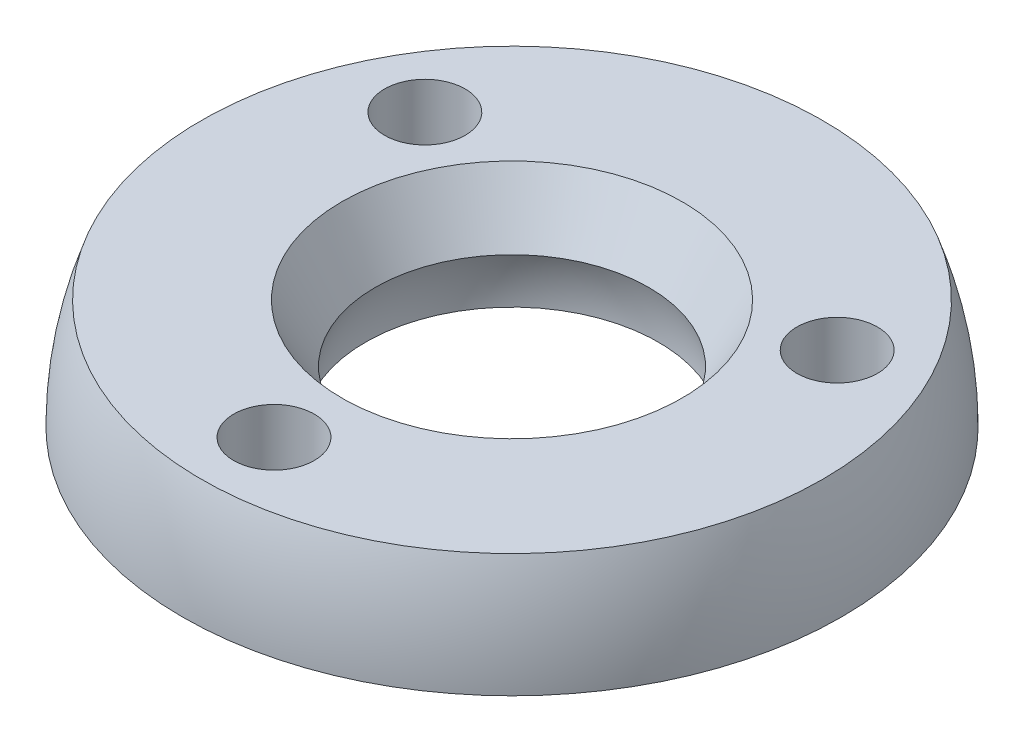
from build123d import *

# Parameters (mm, degrees)
REVOLVE1_ANGLE     = 180
CHAMFER2_SIZE      = 2
SKETCH2_R          = 1.1
CUT_EXTRUDE1_DEPTH = 10


# Read off the part's stored shape, not the designer's step: Body-Delete/Keep 1
with BuildPart() as part:
    # Sketch1 → Revolve1 (revolve)
    with BuildSketch(Plane(origin=(0, 0, 0), x_dir=(1, 0, 0), z_dir=(0, 1, 0))):
        with BuildLine():
            ThreePointArc((9, 0), (6.363961031, 6.363961031), (0, 9))
            Line((0, 9), (0, 4))
            ThreePointArc((0, 4), (2.828427125, 2.828427125), (4, 0))
            ThreePointArc((4, 0), (2.828427125, -2.828427125), (0, -4))
            Line((0, -4), (0, -9))
            ThreePointArc((0, -9), (6.363961031, -6.363961031), (9, 0))
        make_face()
    revolve(axis=Axis((0, 0, -9), (0, 0, 1)), revolution_arc=REVOLVE1_ANGLE)


with BuildPart() as body_2:
    # Split1: the piece on the far side of the plane
    add(part.part)
    split(bisect_by=Plane(origin=(0, 3, 0), x_dir=(-1, 0, 0), z_dir=(0, -1, 0)), keep=Keep.BOTTOM)


with BuildPart() as part_1:
    add(part.part)

    # Split1
    split(bisect_by=Plane(origin=(0, 3, 0), x_dir=(-1, 0, 0), z_dir=(0, -1, 0)), keep=Keep.TOP)

    # Chamfer2
    # the kernel refuses this chamfer: 2, 1.766969722 mm, written as the material it takes off along each edge
    with BuildSketch(Plane(origin=(0, 3, 0), x_dir=(1, 0, 0), z_dir=(0, 0, -1))) as chamfer2_piece_1:
        with BuildLine():
            Line((2.645751311 + CHAMFER2_SIZE, 0), (3.73710994, 1.573813021))
            ThreePointArc((3.73710994, 1.573813021), (3.297092522, 0.735230497), (2.645751311, 0))
            Line((2.645751311, 0), (2.645751311 + CHAMFER2_SIZE, 0))
        make_face()
    revolve(axis=Axis((0, 3, 0), (0, -1, 0)), mode=Mode.SUBTRACT)

    # Sketch2 → Cut-Extrude1 (cut)
    with BuildSketch(Plane.XZ):
        with Locations((0, 6.5)):
            Circle(SKETCH2_R)
        with Locations((5.629165125, -3.25)):
            Circle(SKETCH2_R)
        with Locations((-5.629165125, -3.25)):
            Circle(SKETCH2_R)
    extrude(amount=-CUT_EXTRUDE1_DEPTH, mode=Mode.SUBTRACT)


solid = part_1.part
